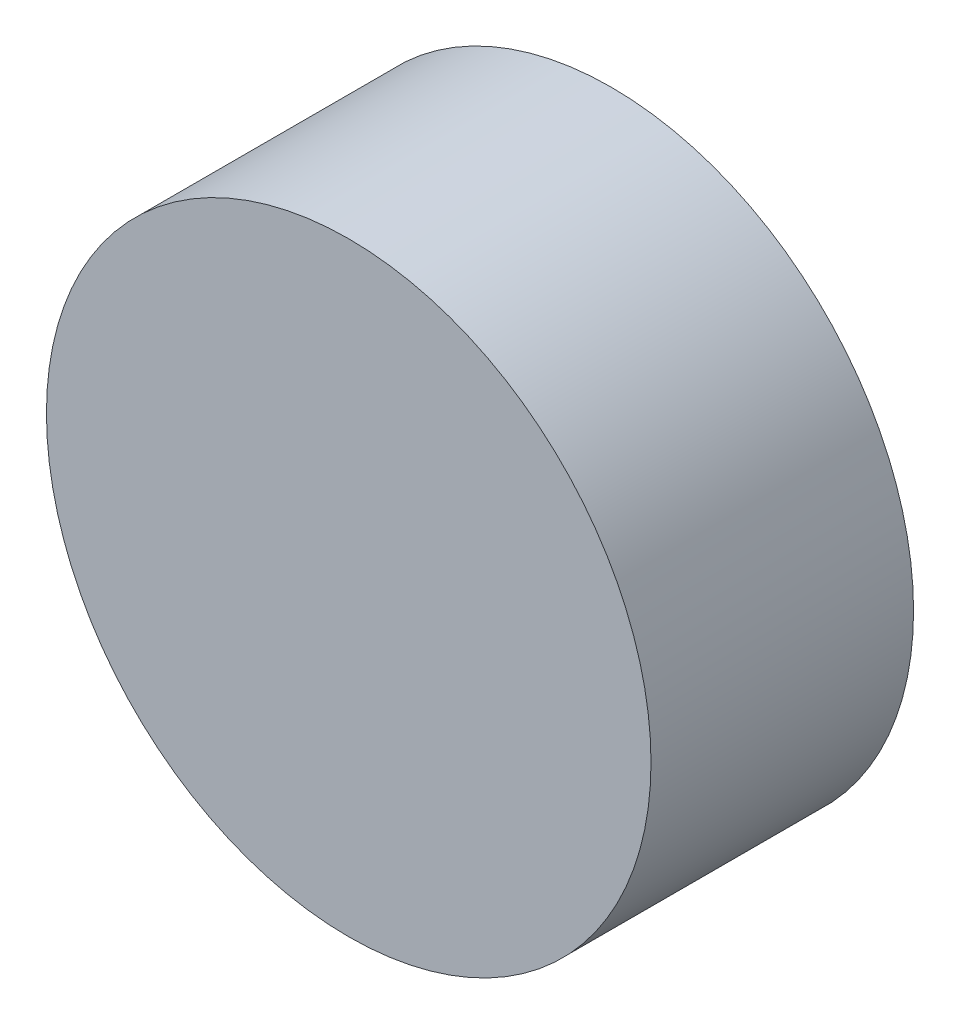
from build123d import *

# Parameters (mm, degrees)
SKETCH1_R           = 13.125
BOSS_EXTRUDE1_DEPTH = 11.4


with BuildPart() as part:
    # Sketch1 → Boss-Extrude1 (new body)
    with BuildSketch(Plane.XY):
        Circle(SKETCH1_R)
    extrude(amount=BOSS_EXTRUDE1_DEPTH)


solid = part.part
